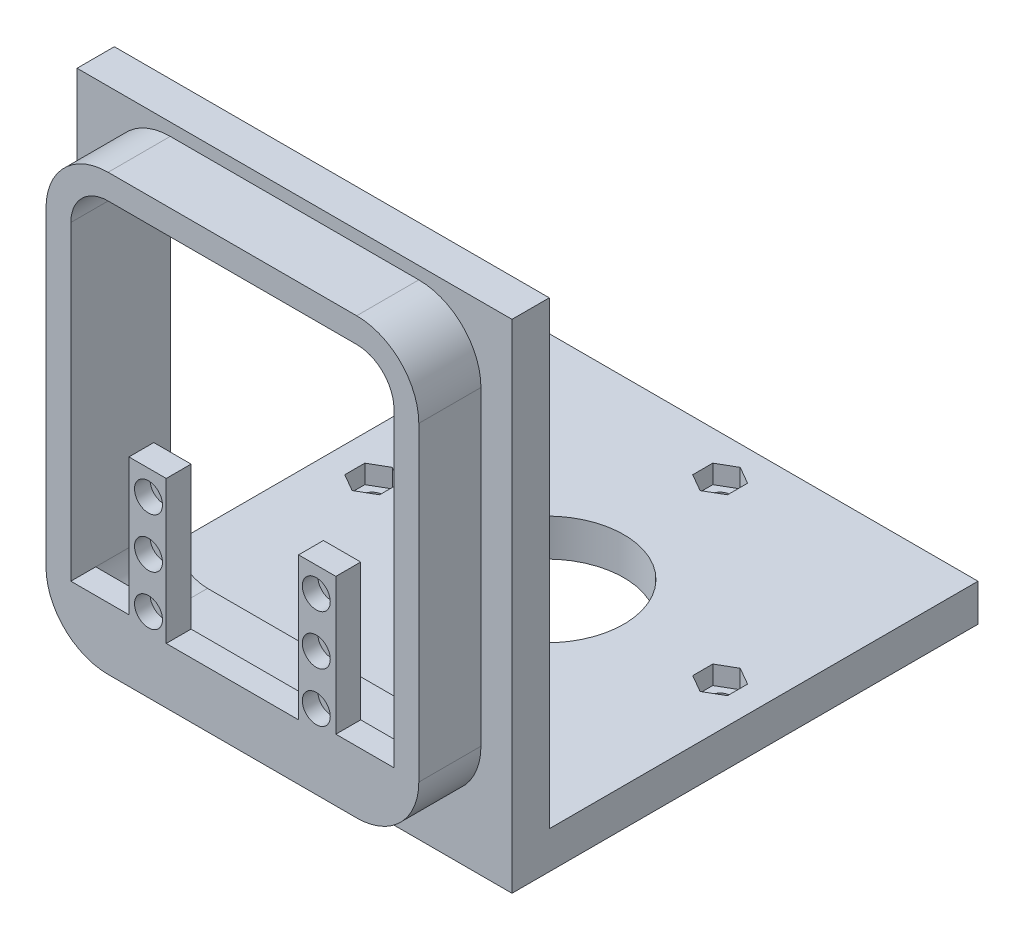
from build123d import *

# Parameters (mm, degrees)
BOSS_EXTRUDE1_DEPTH = 10
SKETCH10_W          = 70
SKETCH10_H          = 80
BOSS_EXTRUDE6_DEPTH = 75
CUT_EXTRUDE7_DEPTH  = 46
SKETCH15_R          = 1.25
BOSS_EXTRUDE7_DEPTH = 4
SKETCH17_R          = 2.25
CUT_EXTRUDE9_DEPTH  = 2.5
SKETCH19_W          = 69
SKETCH19_H          = 74
CUT_EXTRUDE11_DEPTH = 70
SKETCH20_R          = 1.65
CUT_EXTRUDE12_DEPTH = 10
SKETCH21_R          = 12.5
CUT_EXTRUDE13_DEPTH = 10
CUT_EXTRUDE14_DEPTH = 3


with BuildPart() as part:
    # Sketch1 → Boss-Extrude1 (new body)
    with BuildSketch(Plane.XY):
        with BuildLine():
            Line((-20, -35), (20, -35))
            ThreePointArc((20, -35), (27.071067812, -32.071067812), (30, -25))
            Line((30, -25), (30, 25))
            ThreePointArc((30, 25), (27.071067812, 32.071067812), (20, 35))
            Line((20, 35), (-20, 35))
            ThreePointArc((-20, 35), (-27.071067812, 32.071067812), (-30, 25))
            Line((-30, 25), (-30, -25))
            ThreePointArc((-30, -25), (-27.071067812, -32.071067812), (-20, -35))
        make_face()
    extrude(amount=-BOSS_EXTRUDE1_DEPTH)

    # Sketch10 → Boss-Extrude6 (add)
    with BuildSketch(Plane(origin=(0, 0, -10), x_dir=(-1, 0, 0), z_dir=(0, 0, -1))):
        with Locations((0, -3)):
            Rectangle(SKETCH10_W, SKETCH10_H)
    extrude(amount=BOSS_EXTRUDE6_DEPTH)

    # Sketch14 → Cut-Extrude7 (cut)
    with BuildSketch(Plane.XY):
        with BuildLine():
            Line((20, 31), (-20, 31))
            ThreePointArc((-20, 31), (-24.242640687, 29.242640687), (-26, 25))
            Line((-26, 25), (-26, -25))
            ThreePointArc((-26, -25), (-24.242640687, -29.242640687), (-20, -31))
            Line((-20, -31), (20, -31))
            ThreePointArc((20, -31), (24.242640687, -29.242640687), (26, -25))
            Line((26, -25), (26, 25))
            ThreePointArc((26, 25), (24.242640687, 29.242640687), (20, 31))
        make_face()
    extrude(amount=-CUT_EXTRUDE7_DEPTH, mode=Mode.SUBTRACT)

    # Sketch15 → Boss-Extrude7 (add)
    with BuildSketch(Plane.XY):
        with BuildLine():
            Line((-16.65, -3), (-10.65, -3))
            Line((-10.65, -3), (-10.65, -26))
            Line((-10.65, -26), (10.65, -26))
            Line((10.65, -26), (10.65, -3))
            Line((10.65, -3), (16.65, -3))
            Line((16.65, -3), (16.65, -25))
            Line((16.65, -25), (26, -25))
            ThreePointArc((26, -25), (24.242640687, -29.242640687), (20, -31))
            Line((20, -31), (-20, -31))
            ThreePointArc((-20, -31), (-24.242640687, -29.242640687), (-26, -25))
            Line((-26, -25), (-16.65, -25))
            Line((-16.65, -25), (-16.65, -3))
        make_face()
        with Locations((13.5, -7)):
            Circle(SKETCH15_R, mode=Mode.SUBTRACT)
        with Locations((13.5, -15)):
            Circle(SKETCH15_R, mode=Mode.SUBTRACT)
        with Locations((13.5, -23)):
            Circle(SKETCH15_R, mode=Mode.SUBTRACT)
        with Locations((-13.5, -7)):
            Circle(SKETCH15_R, mode=Mode.SUBTRACT)
        with Locations((-13.5, -15)):
            Circle(SKETCH15_R, mode=Mode.SUBTRACT)
        with Locations((-13.5, -23)):
            Circle(SKETCH15_R, mode=Mode.SUBTRACT)
    extrude(amount=-BOSS_EXTRUDE7_DEPTH)

    # Sketch17 → Cut-Extrude9 (cut)
    with BuildSketch(Plane.XY):
        with Locations((-13.5, -7)):
            Circle(SKETCH17_R)
        with Locations((-13.5, -15)):
            Circle(SKETCH17_R)
        with Locations((-13.5, -23)):
            Circle(SKETCH17_R)
        with Locations((13.5, -7)):
            Circle(SKETCH17_R)
        with Locations((13.5, -15)):
            Circle(SKETCH17_R)
        with Locations((13.5, -23)):
            Circle(SKETCH17_R)
    extrude(amount=-CUT_EXTRUDE9_DEPTH, mode=Mode.SUBTRACT)

    # Sketch19 → Cut-Extrude11 (cut)
    with BuildSketch(Plane(origin=(35, 0, 0), x_dir=(0, 0, -1), z_dir=(1, 0, 0))):
        with Locations((50.5, 0)):
            Rectangle(SKETCH19_W, SKETCH19_H)
    extrude(amount=-CUT_EXTRUDE11_DEPTH, mode=Mode.SUBTRACT)

    # Sketch20 → Cut-Extrude12 (cut)
    with BuildSketch(Plane.XZ.offset(43)):
        with Locations((28, -50.5)):
            Circle(SKETCH20_R)
        with Locations((0, -78.5)):
            Circle(SKETCH20_R)
        with Locations((-28, -50.5)):
            Circle(SKETCH20_R)
    extrude(amount=-CUT_EXTRUDE12_DEPTH, mode=Mode.SUBTRACT)

    # Sketch21 → Cut-Extrude13 (cut)
    with BuildSketch(Plane(origin=(0, -37, 0), x_dir=(1, 0, 0), z_dir=(0, 1, 0))):
        with Locations((0, 50.5)):
            Circle(SKETCH21_R)
    extrude(amount=-CUT_EXTRUDE13_DEPTH, mode=Mode.SUBTRACT)

    # Sketch22 → Cut-Extrude14 (cut)
    with BuildSketch(Plane(origin=(0, -37, 0), x_dir=(1, 0, 0), z_dir=(0, 1, 0))):
        Polygon((0, 81.733161507), (-2.8, 80.116580754), (-2.8, 76.883419246), (0, 75.266838493), (2.8, 76.883419246), (2.8, 80.116580754), align=None)
        Polygon((-30.8, 48.883419246), (-28, 47.266838493), (-25.2, 48.883419246), (-25.2, 52.116580754), (-28, 53.733161507), (-30.8, 52.116580754), align=None)
        Polygon((28, 53.733161507), (25.2, 52.116580754), (25.2, 48.883419246), (28, 47.266838493), (30.8, 48.883419246), (30.8, 52.116580754), align=None)
    extrude(amount=-CUT_EXTRUDE14_DEPTH, mode=Mode.SUBTRACT)


solid = part.part
